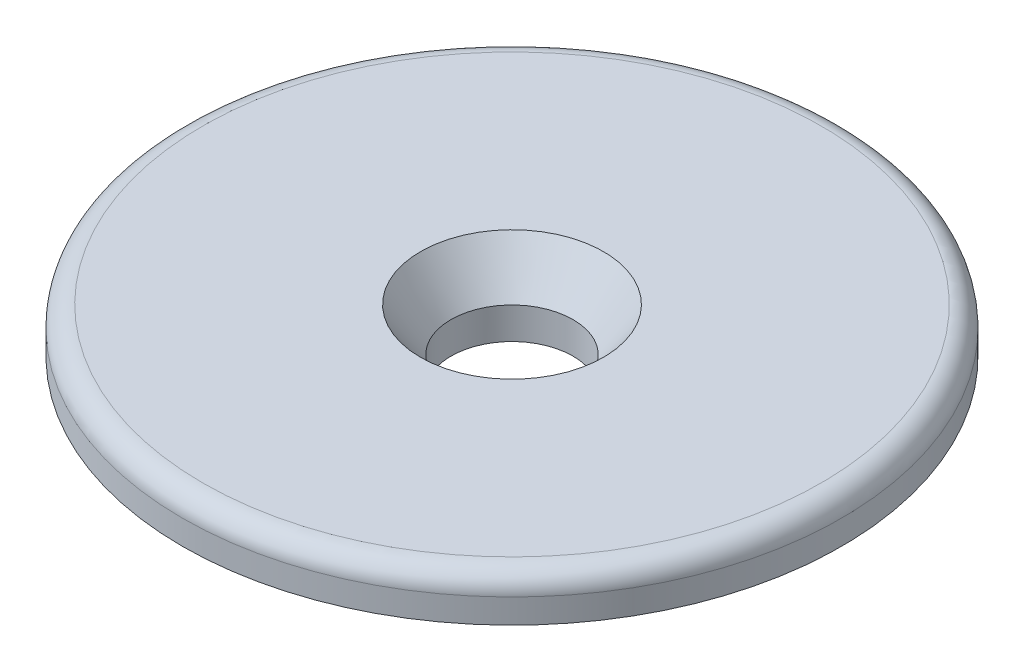
from build123d import *

# Parameters (mm, degrees)
CROQUIS1_R              = 16.2
CROQUIS1_R_2            = 3
SALIENTE_EXTRUIR1_DEPTH = 2.2
SALIENTE_EXTRUIR2_START = 1.5
CROQUIS2_R              = 13.5
CROQUIS2_R_2            = 3
SALIENTE_EXTRUIR2_DEPTH = 1.5
REDONDEO1_R             = 1
CHAFL_N1_SIZE           = 1.5
CHAFL_N1_SIZE2          = 2.14222201


with BuildPart() as part:
    # Croquis1 → Saliente-Extruir1 (new body)
    with BuildSketch(Plane(origin=(0, 0, 0), x_dir=(1, 0, 0), z_dir=(0, 1, 0))):
        Circle(CROQUIS1_R)
        Circle(CROQUIS1_R_2, mode=Mode.SUBTRACT)
    extrude(amount=SALIENTE_EXTRUIR1_DEPTH)

    # Croquis2 → Saliente-Extruir2 (add)
    with BuildSketch(Plane.XZ.offset(SALIENTE_EXTRUIR2_START)):
        Circle(CROQUIS2_R)
        Circle(CROQUIS2_R_2, mode=Mode.SUBTRACT)
    extrude(amount=-SALIENTE_EXTRUIR2_DEPTH)

    # Redondeo1
    redondeo1_edges = [part.edges().sort_by_distance(p)[0] for p in [
        (-16.2, 2.2, 0),
    ]]
    fillet(redondeo1_edges, radius=REDONDEO1_R)

    # Chaflán1
    chafl_n1_edges = [part.edges().sort_by_distance(p)[0] for p in [
        (-3, 2.2, 0),
    ]]
    chafl_n1_side = [part.faces().sort_by_distance(p)[0] for p in [
        (-14.770079077, 2.2, 0),
    ]]
    chamfer(chafl_n1_edges, length=CHAFL_N1_SIZE, length2=CHAFL_N1_SIZE2, reference=chafl_n1_side[0])


solid = part.part
